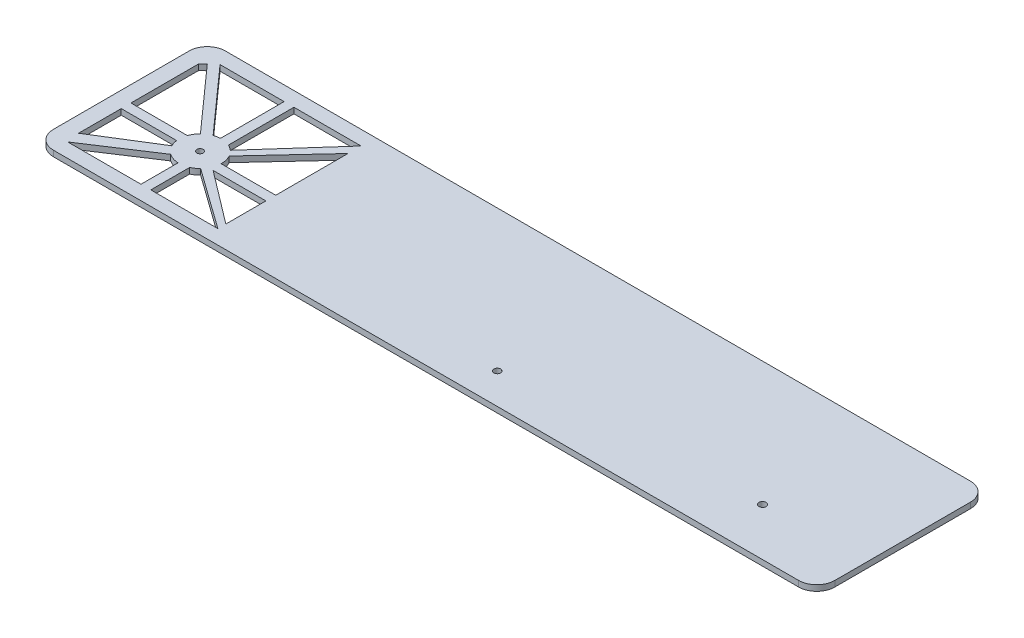
from build123d import *

# Parameters (mm, degrees)
SKETCH1_W           = 431.8
SKETCH1_H           = 95
SKETCH1_R           = 1.770184209
SKETCH1_R_2         = 1.902933344
SKETCH1_R_3         = 2
BOSS_EXTRUDE1_DEPTH = 3.175
FILLET1_R           = 10
SKETCH10_R          = 9.179936936
BOSS_EXTRUDE3_DEPTH = 3.175
SKETCH11_R          = 1.770587682
CUT_EXTRUDE5_DEPTH  = 3.175
CUT_EXTRUDE6_DEPTH  = 3.175
SKETCH13_R          = 11.741940518
BOSS_EXTRUDE4_DEPTH = 3.175
SKETCH14_R          = 1.762256498
CUT_EXTRUDE8_DEPTH  = 3.175


with BuildPart() as part:
    # Sketch1 → Boss-Extrude1 (new body)
    with BuildSketch(Plane(origin=(0, 0, 0), x_dir=(1, 0, 0), z_dir=(0, 1, 0))):
        with Locations((213.767466267, 47.5)):
            Rectangle(SKETCH1_W, SKETCH1_H)
        with Locations((48.867466267, 40.050297191)):
            Circle(SKETCH1_R, mode=Mode.SUBTRACT)
        with Locations((236.169368623, 16.995054431)):
            Circle(SKETCH1_R_2, mode=Mode.SUBTRACT)
        with Locations((373.343160921, 26.368316597)):
            Circle(SKETCH1_R_3, mode=Mode.SUBTRACT)
    extrude(amount=BOSS_EXTRUDE1_DEPTH)

    # Fillet1
    fillet1_edges = [part.edges().sort_by_distance(p)[0] for p in [
        (429.667466267, 1.5875, -95),
        (429.667466267, 1.5875, 0),
        (-2.132533733, 1.5875, 0),
        (-2.132533733, 1.5875, -95),
    ]]
    fillet(fillet1_edges, radius=FILLET1_R)

    # Sketch10 → Boss-Extrude3 (add)
    with BuildSketch(Plane.XZ):
        with Locations((48.867466267, -40.050297191)):
            Circle(SKETCH10_R)
    extrude(amount=-BOSS_EXTRUDE3_DEPTH)

    # Sketch11 → Cut-Extrude5 (cut)
    with BuildSketch(Plane(origin=(0, 3.175, 0), x_dir=(1, 0, 0), z_dir=(0, 1, 0))):
        with Locations((48.939345921, 40.088578466)):
            Circle(SKETCH11_R)
    extrude(amount=-CUT_EXTRUDE5_DEPTH, mode=Mode.SUBTRACT)

    # Sketch12 → Cut-Extrude6 (cut)
    with BuildSketch(Plane(origin=(0, 3.175, 0), x_dir=(1, 0, 0), z_dir=(0, 1, 0))):
        Polygon((48.341279917, 47.334727349), (48.341279917, 86.998039631), (12.939315235, 86.998039631), align=None)
        Polygon((44.60489186, 43.999769414), (9.202927178, 83.663081696), (6.684860974, 81.41555153), (6.684860974, 43.999769414), align=None)
        Polygon((44.60489186, 38.648134163), (6.684860974, 38.648134163), (6.684860974, 15.046824375), align=None)
        Polygon((7.853230038, 7.893935302), (48.341279917, 34.438493177), (48.341279917, 7.893935302), (44.60489186, 7.893935302), align=None)
        Polygon((55.459972177, 47.334727349), (90.838679195, 86.998039631), (55.459972177, 86.998039631), (53.759123425, 86.998039631), (53.759123425, 45.871199809), align=None)
        Polygon((90.838679195, 39.858977136), (90.838679195, 79.830290994), (55.833686687, 42.095331309), (55.833686687, 39.858977136), align=None)
        Polygon((53.759123425, 34.438493177), (53.759123425, 7.893935302), (90.838679195, 7.893935302), align=None)
        Polygon((61.64788979, 34.438493177), (90.838679195, 12.290395062), (90.838679195, 34.438493177), align=None)
    extrude(amount=-CUT_EXTRUDE6_DEPTH, mode=Mode.SUBTRACT)

    # Sketch13 → Boss-Extrude4 (add)
    with BuildSketch(Plane(origin=(0, 3.175, 0), x_dir=(1, 0, 0), z_dir=(0, 1, 0))):
        with Locations((48.939345921, 40.088578466)):
            Circle(SKETCH13_R)
    extrude(amount=-BOSS_EXTRUDE4_DEPTH)

    # Sketch14 → Cut-Extrude8 (cut)
    with BuildSketch(Plane(origin=(0, 3.175, 0), x_dir=(1, 0, 0), z_dir=(0, 1, 0))):
        with Locations((48.870433526, 40.018247237)):
            Circle(SKETCH14_R)
    extrude(amount=-CUT_EXTRUDE8_DEPTH, mode=Mode.SUBTRACT)


solid = part.part
